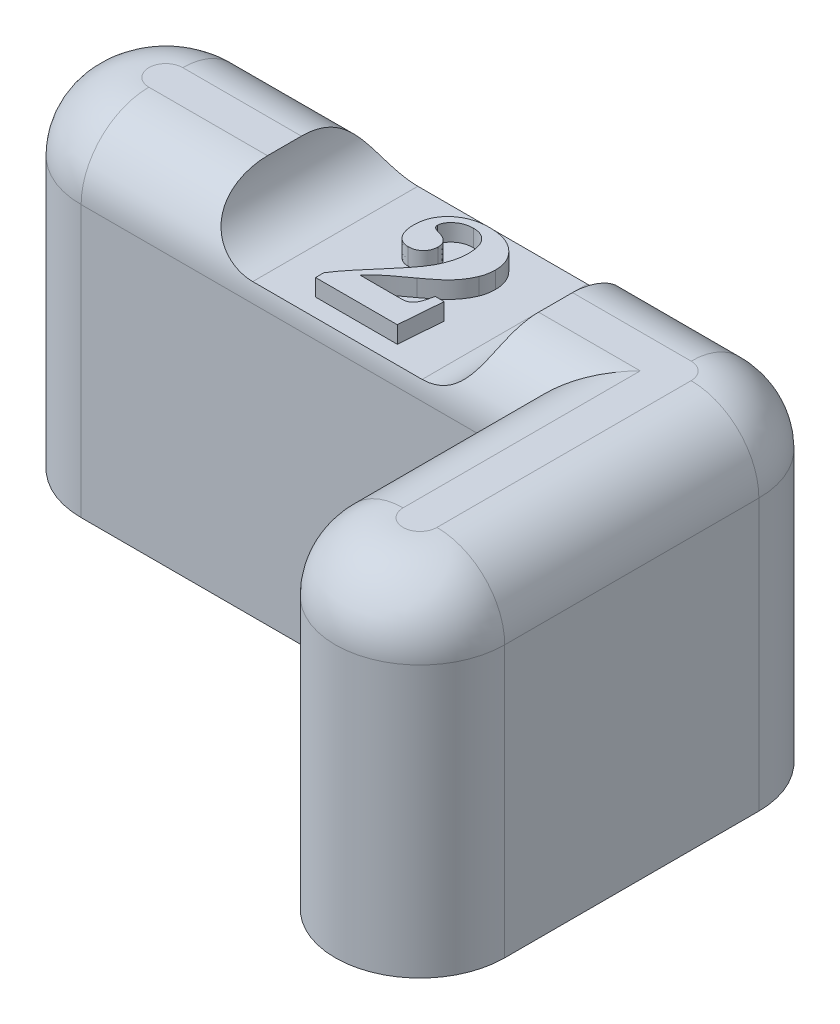
from build123d import *

# Parameters (mm, degrees)
BOSS_EXTRUDE1_DEPTH     = 20
FILLET1_R               = 4
SKETCH2_R               = 2.75
CUT_EXTRUDE1_DEPTH      = 1.5
LPATTERN1_COUNT         = 2
LPATTERN1_PITCH         = 30
CUT_EXTRUDE2_DEPTH      = 35.641016151
CUT_EXTRUDE2_DEPTH_BACK = 35.641016151
WRAP1_DEPTH             = 1


# Read off the part's stored shape, not the designer's step: Wrap1
with BuildPart() as part:
    # Sketch1 → Boss-Extrude1 (new body)
    with BuildSketch(Plane(origin=(0, 0, 0), x_dir=(1, 0, 0), z_dir=(0, 1, 0))):
        with BuildLine():
            Line((-15, -5), (10, -5))
            Line((10, -5), (10, -15))
            ThreePointArc((10, -15), (15, -20), (20, -15))
            Line((20, -15), (20, 0))
            ThreePointArc((20, 0), (18.535533906, 3.535533906), (15, 5))
            Line((15, 5), (-15, 5))
            ThreePointArc((-15, 5), (-20, 0), (-15, -5))
        make_face()
    extrude(amount=BOSS_EXTRUDE1_DEPTH)

    # Fillet1
    fillet1_edges = [part.edges().sort_by_distance(p)[0] for p in [
        (15, 20, 20),
        (20, 20, 7.5),
        (18.535533906, 20, -3.535533906),
        (0, 20, -5),
        (-20, 20, 0),
        (-2.5, 20, 5),
        (10, 20, 10),
    ]]
    fillet(fillet1_edges, radius=FILLET1_R)

    # Sketch2 → Cut-Extrude1 (cut)
    with BuildSketch(Plane.XZ):
        with Locations(Location((-15, 0, 0), (0, 0, 270))):
            Circle(SKETCH2_R)
    cut_extrude1 = extrude(amount=-CUT_EXTRUDE1_DEPTH, mode=Mode.SUBTRACT)

    # LPattern1: Cut-Extrude1 ×2
    with Locations(*[(i * LPATTERN1_PITCH, 0, 0) for i in range(1, LPATTERN1_COUNT)]):
        add(cut_extrude1, mode=Mode.SUBTRACT)

    # Sketch3 → Cut-Extrude2 (cut, two sides: drawn at the far end of the back side and taken through both)
    with BuildSketch(Plane.XY.offset(-CUT_EXTRUDE2_DEPTH_BACK)):
        with BuildLine():
            Line((5, 17), (-5, 17))
            ThreePointArc((-5, 17), (-8, 20), (-5, 23))
            Line((-5, 23), (5, 23))
            ThreePointArc((5, 23), (8, 20), (5, 17))
        make_face()
    extrude(amount=CUT_EXTRUDE2_DEPTH + CUT_EXTRUDE2_DEPTH_BACK, mode=Mode.SUBTRACT)

    # Wrap1 outline → Wrap1 (add)
    with BuildSketch(Plane(origin=(0, 17, 0), x_dir=(1, 0, 0), z_dir=(0, 1, 0))):
        with BuildLine():
            add(Edge.make_bspline(
                [(1.279846376, -2.374028678), (1.334628235, -2.372005919), (1.439423638, -2.368136466), (1.586709387, -2.326690884), (1.715405832, -2.260778282), (1.805401117, -2.180421216), (1.866547055, -2.099402851), (1.91146986, -2.023004422), (1.954343809, -1.931092566), (1.995394653, -1.823787438), (2.03540343, -1.701296934), (2.074075054, -1.563508285), (2.108116131, -1.409568974), (2.130405187, -1.301938193), (2.142025864, -1.245823549)],
                knots=[0, 0, 0, 0, 0.10403341, 0.199011557, 0.288612319, 0.377191825, 0.425797175, 0.481425289, 0.545557079, 0.61863331, 0.699984683, 0.790771883, 0.890916323, 1, 1, 1, 1], degree=3))
            Line((1.279846376, -2.374028678), (-1.19130747, -2.374028678))
            add(Edge.make_bspline(
                [(0.670872017, -0.840374831), (0.598877184, -0.892890897), (0.460407765, -0.993896327), (0.259247648, -1.136582046), (0.079136214, -1.2721954), (-0.085697103, -1.393939001), (-0.231791362, -1.50542791), (-0.360742391, -1.605057789), (-0.471476435, -1.693040171), (-0.650584686, -1.841423278), (-0.895932385, -2.060152678), (-1.093407848, -2.269997081), (-1.19130747, -2.374028678)],
                knots=[0, 0, 0, 0, 0.110593572, 0.212707314, 0.306051588, 0.390379305, 0.467018215, 0.534117187, 0.592614819, 0.642525788, 0.822780058, 1, 1, 1, 1], degree=3))
            add(Edge.make_bspline(
                [(2.414461761, 1.068279015), (2.378068935, 0.984722167), (2.306117333, 0.819523423), (2.171764082, 0.586037142), (2.024257932, 0.364395962), (1.882362056, 0.191285153), (1.756342108, 0.053944192), (1.645356158, -0.054277839), (1.52024596, -0.169630314), (1.380454268, -0.29172845), (1.224880603, -0.419904333), (1.052848506, -0.553709461), (0.868059484, -0.696771215), (0.737896342, -0.79156374), (0.670872017, -0.840374831)],
                knots=[0, 0, 0, 0, 0.10413489, 0.205883221, 0.307528832, 0.408265615, 0.461433854, 0.520606469, 0.585444086, 0.656004792, 0.732803839, 0.815893726, 0.905198979, 1, 1, 1, 1], degree=3))
            add(Edge.make_bspline(
                [(2.569910479, 1.893599528), (2.568142746, 1.81978224), (2.56468278, 1.675300383), (2.535113724, 1.46316539), (2.486055205, 1.260681768), (2.438163447, 1.131975763), (2.414461761, 1.068279015)],
                knots=[0, 0, 0, 0, 0.261979501, 0.512769921, 0.758869279, 1, 1, 1, 1], degree=3))
            add(Edge.make_bspline(
                [(0.249397658, 3.882381579), (0.333852401, 3.880295856), (0.499413602, 3.876207099), (0.741908223, 3.851223526), (0.971759136, 3.80593405), (1.18959295, 3.744264137), (1.393306246, 3.661376278), (1.586046869, 3.564171248), (1.76456817, 3.445680325), (1.930217215, 3.311921517), (2.08021151, 3.165619914), (2.21133761, 3.008910571), (2.322587283, 2.843726724), (2.412544984, 2.66919338), (2.484129314, 2.487396013), (2.533041577, 2.296802227), (2.565160525, 2.098215825), (2.568307798, 1.962639068), (2.569910479, 1.893599528)],
                knots=[0, 0, 0, 0, 0.074102612, 0.14526736, 0.21355926, 0.279416432, 0.343556942, 0.406228654, 0.468492489, 0.531146675, 0.592790073, 0.652016559, 0.710119813, 0.767135501, 0.823967905, 0.881147087, 0.939476717, 1, 1, 1, 1], degree=3))
            add(Edge.make_bspline(
                [(-1.595153624, 3.18366363), (-1.537018416, 3.239488538), (-1.421267077, 3.350639908), (-1.227322021, 3.49323037), (-1.01917847, 3.614849236), (-0.794503481, 3.712369576), (-0.555192573, 3.789539817), (-0.300158666, 3.843743016), (-0.03027423, 3.875864088), (0.154757504, 3.880176079), (0.249397658, 3.882381579)],
                knots=[0, 0, 0, 0, 0.119107626, 0.23715177, 0.355050392, 0.47498588, 0.598670295, 0.726365388, 0.860041186, 1, 1, 1, 1], degree=3))
            add(Edge.make_bspline(
                [(-2.148038239, 1.770202092), (-2.146834557, 1.839213319), (-2.1444639, 1.975131192), (-2.115761448, 2.174024084), (-2.0725438, 2.364349945), (-2.013797101, 2.547053872), (-1.93451202, 2.719957511), (-1.839205925, 2.884783326), (-1.727409324, 3.041427104), (-1.639506749, 3.135963346), (-1.595153624, 3.18366363)],
                knots=[0, 0, 0, 0, 0.132803649, 0.26155729, 0.386082589, 0.508400008, 0.630401232, 0.751619273, 0.874674186, 1, 1, 1, 1], degree=3))
            add(Edge.make_bspline(
                [(-1.208935675, 0.497766194), (-1.274132827, 0.50149434), (-1.401855252, 0.508797847), (-1.58379437, 0.575310486), (-1.747403804, 0.682290997), (-1.890553306, 0.830420443), (-2.008834141, 1.01608116), (-2.088271481, 1.239599951), (-2.141324633, 1.493680029), (-2.145722196, 1.674808207), (-2.148038239, 1.770202092)],
                knots=[0, 0, 0, 0, 0.110139331, 0.215764983, 0.323707128, 0.438906263, 0.562183724, 0.693638164, 0.838649921, 1, 1, 1, 1], degree=3))
            add(Edge.make_bspline(
                [(-0.301884393, 1.369561066), (-0.304766572, 1.30886225), (-0.310374385, 1.190761489), (-0.360035913, 1.021550791), (-0.443342029, 0.869740737), (-0.557930256, 0.738678363), (-0.695194398, 0.631756347), (-0.851287883, 0.551805139), (-1.025431534, 0.507328091), (-1.146729825, 0.50100757), (-1.208935675, 0.497766194)],
                knots=[0, 0, 0, 0, 0.129242333, 0.251464839, 0.372304265, 0.495878621, 0.620081591, 0.741344555, 0.867352775, 1, 1, 1, 1], degree=3))
            add(Edge.make_bspline(
                [(-0.962140803, 2.109945681), (-0.909824085, 2.094806974), (-0.81039346, 2.066035077), (-0.675027986, 2.002430367), (-0.560830979, 1.92712373), (-0.46427764, 1.841406615), (-0.391475884, 1.740340724), (-0.339690156, 1.627067557), (-0.306087178, 1.502350913), (-0.303311641, 1.414655948), (-0.301884393, 1.369561066)],
                knots=[0, 0, 0, 0, 0.151156851, 0.287281401, 0.413669873, 0.530293514, 0.644009236, 0.756908248, 0.874996313, 1, 1, 1, 1], degree=3))
            add(Edge.make_bspline(
                [(-1.348358752, 2.265394399), (-1.330621209, 2.251855949), (-1.288474303, 2.219686679), (-1.202511656, 2.184828621), (-1.092623552, 2.143667428), (-1.00837918, 2.121895451), (-0.962140803, 2.109945681)],
                knots=[0, 0, 0, 0, 0.159109439, 0.378066483, 0.65864549, 1, 1, 1, 1], degree=3))
            add(Edge.make_bspline(
                [(-1.430089521, 2.464112348), (-1.429415195, 2.444204185), (-1.428114492, 2.405803442), (-1.411058666, 2.351977791), (-1.385555484, 2.303870537), (-1.360780125, 2.278243013), (-1.348358752, 2.265394399)],
                knots=[0, 0, 0, 0, 0.268945253, 0.518766978, 0.758729042, 1, 1, 1, 1], degree=3))
            add(Edge.make_bspline(
                [(-0.197717726, 3.369561066), (-0.28241452, 3.365853817), (-0.446198046, 3.358684877), (-0.681222607, 3.303774927), (-0.893632691, 3.209273649), (-1.077682983, 3.0804735), (-1.229219898, 2.93431847), (-1.344105461, 2.782798304), (-1.415738038, 2.624883436), (-1.425407352, 2.516563894), (-1.430089521, 2.464112348)],
                knots=[0, 0, 0, 0, 0.151816317, 0.293576777, 0.429964406, 0.566304914, 0.694365033, 0.806085808, 0.906100976, 1, 1, 1, 1], degree=3))
            add(Edge.make_bspline(
                [(0.928884838, 1.959304656), (0.928086086, 2.015438052), (0.926539001, 2.124161628), (0.911151444, 2.281372808), (0.890291843, 2.428618132), (0.855346146, 2.564724047), (0.815441285, 2.692385245), (0.761060485, 2.807885158), (0.701186968, 2.914806673), (0.629381656, 3.009462922), (0.551801509, 3.095312), (0.463668068, 3.167247991), (0.370794497, 3.230338766), (0.271044111, 3.28236916), (0.163381009, 3.320276983), (0.04991907, 3.349915646), (-0.071775658, 3.365230608), (-0.154947449, 3.36809043), (-0.197717726, 3.369561066)],
                knots=[0, 0, 0, 0, 0.082284271, 0.159374645, 0.231497254, 0.300083139, 0.36523236, 0.427274673, 0.486932074, 0.544586116, 0.60112786, 0.656190593, 0.710940404, 0.765594865, 0.820607428, 0.877984079, 0.93725451, 1, 1, 1, 1], degree=3))
            add(Edge.make_bspline(
                [(0.517025864, 0.374368758), (0.549928586, 0.43914421), (0.615149426, 0.567544204), (0.697152899, 0.765273295), (0.770951673, 0.962291119), (0.827867417, 1.161343452), (0.873192914, 1.360332754), (0.905111682, 1.559455639), (0.92522592, 1.759102273), (0.927663621, 1.892484206), (0.928884838, 1.959304656)],
                knots=[0, 0, 0, 0, 0.131745637, 0.261150462, 0.388067803, 0.513189353, 0.636374668, 0.758087597, 0.878808958, 1, 1, 1, 1], degree=3))
            add(Edge.make_bspline(
                [(-0.805089521, -1.369220985), (-0.723674568, -1.275391825), (-0.566728304, -1.09451429), (-0.344338673, -0.83116064), (-0.144847313, -0.585533161), (0.031128622, -0.358191092), (0.186040311, -0.149965293), (0.317060652, 0.040597284), (0.427968481, 0.211694057), (0.488762816, 0.322742687), (0.517025864, 0.374368758)],
                knots=[0, 0, 0, 0, 0.170005554, 0.327725258, 0.471696803, 0.603008639, 0.721148947, 0.826797124, 0.919478664, 1, 1, 1, 1], degree=3))
            add(Edge.make_bspline(
                [(-2.353166444, -3.319541498), (-2.317411217, -3.262535334), (-2.240300808, -3.139594747), (-2.103504918, -2.950449774), (-1.948026633, -2.736340024), (-1.76326396, -2.505230848), (-1.559031147, -2.249795036), (-1.329305353, -1.9745526), (-1.076183846, -1.67797272), (-0.897762158, -1.474766675), (-0.805089521, -1.369220985)],
                knots=[0, 0, 0, 0, 0.080973991, 0.174630064, 0.280853316, 0.39944862, 0.530692677, 0.674513651, 0.830941638, 1, 1, 1, 1], degree=3))
            Line((-2.353166444, -3.319541498), (-2.353166444, -3.809926113))
            Line((-2.353166444, -3.809926113), (2.467346376, -3.809926113))
            Line((2.467346376, -3.809926113), (2.672474581, -1.245823549))
            Line((2.672474581, -1.245823549), (2.142025864, -1.245823549))
        make_face()
    extrude(amount=WRAP1_DEPTH)


solid = part.part
